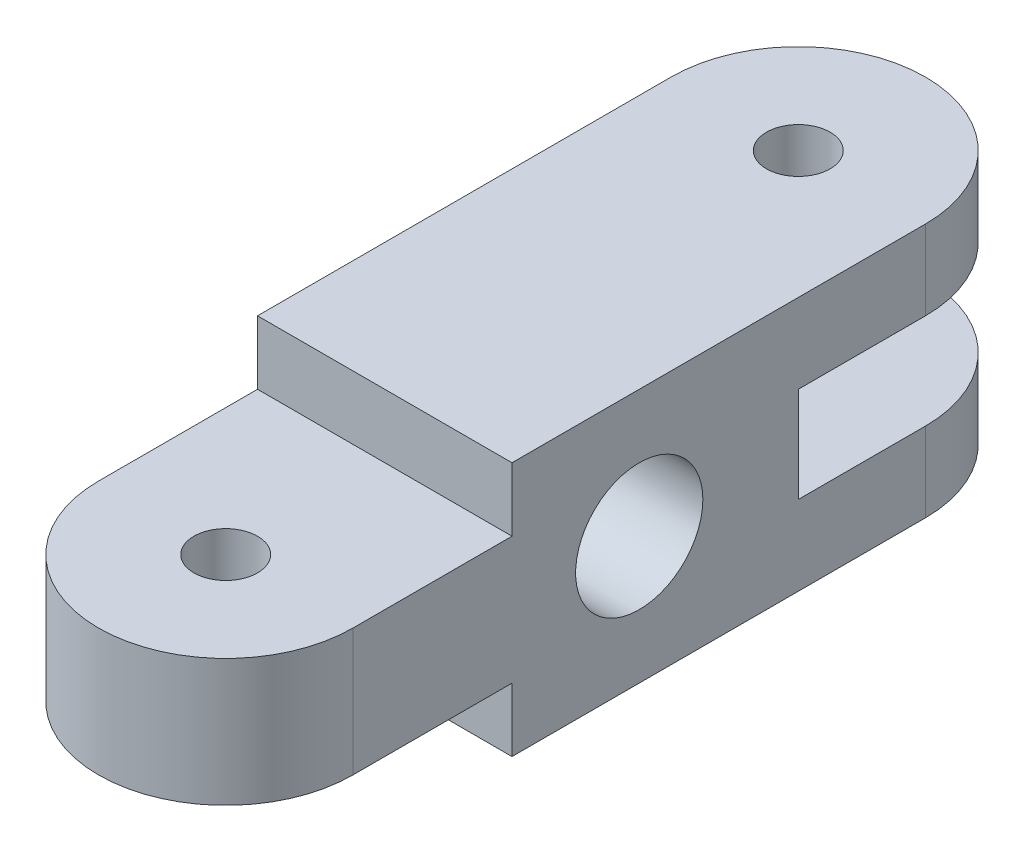
from build123d import *

# Parameters (mm, degrees)
SKETCH2_W           = 25.4
SKETCH2_H           = 25.4
BOSS_EXTRUDE1_DEPTH = 41.275
SKETCH3_R           = 6.35
SKETCH3_W           = 28.575
SKETCH3_H           = 6.35
SKETCH3_W_2         = 25.4
SKETCH3_H_2         = 9.525
CUT_EXTRUDE1_DEPTH  = 51.100654936
SKETCH4_R           = 3.175
CUT_EXTRUDE2_DEPTH  = 51.100654936


with BuildPart() as part:
    # Sketch2 → Boss-Extrude1 (new, symmetric)
    with BuildSketch(Plane.XY):
        Rectangle(SKETCH2_W, SKETCH2_H)
    extrude(amount=BOSS_EXTRUDE1_DEPTH, both=True)

    # Sketch3 → Cut-Extrude1 (cut, through all)
    with BuildSketch(Plane(origin=(12.7, 0, 0), x_dir=(0, 0, -1), z_dir=(1, 0, 0))):
        Circle(SKETCH3_R)
        with Locations((-26.9875, 9.525)):
            Rectangle(SKETCH3_W, SKETCH3_H)
        with Locations((-26.9875, -9.525)):
            Rectangle(SKETCH3_W, SKETCH3_H)
        with Locations((28.575, 0)):
            Rectangle(SKETCH3_W_2, SKETCH3_H_2)
    extrude(amount=-CUT_EXTRUDE1_DEPTH, mode=Mode.SUBTRACT)

    # Sketch4 → Cut-Extrude2 (cut, through all)
    with BuildSketch(Plane(origin=(0, 12.7, 0), x_dir=(1, 0, 0), z_dir=(0, 1, 0))):
        with Locations((0, 28.575)):
            Circle(SKETCH4_R)
        with Locations((0, -28.575)):
            Circle(SKETCH4_R)
        with BuildLine():
            Line((-12.7, 28.575), (-12.7, 47.625))
            Line((-12.7, 47.625), (12.7, 47.625))
            Line((12.7, 47.625), (12.7, 28.575))
            ThreePointArc((12.7, 28.575), (0, 41.275), (-12.7, 28.575))
        make_face()
        with BuildLine():
            Line((-12.7, -28.575), (-12.7, -47.625))
            Line((-12.7, -47.625), (12.7, -47.625))
            Line((12.7, -47.625), (12.7, -28.575))
            ThreePointArc((12.7, -28.575), (0, -41.275), (-12.7, -28.575))
        make_face()
    extrude(amount=-CUT_EXTRUDE2_DEPTH, mode=Mode.SUBTRACT)


solid = part.part
